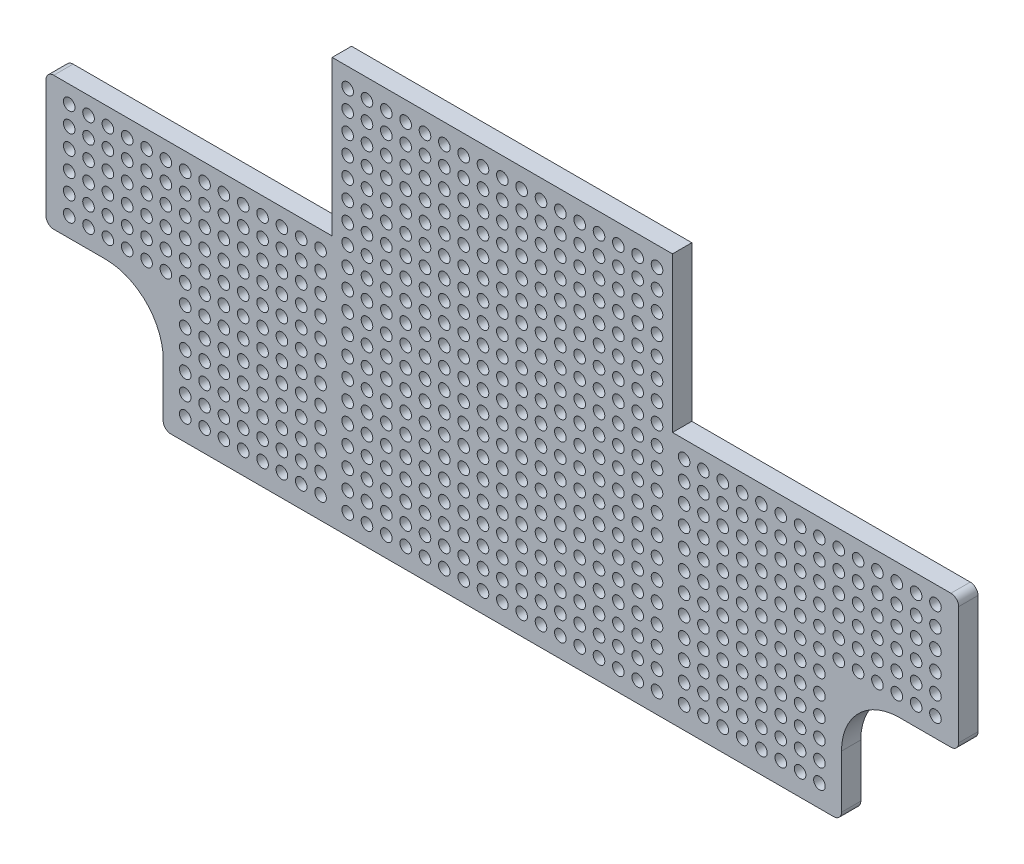
from build123d import *

# Parameters (mm, degrees)
ESQUISSE1_R        = 1.5
BOSS_EXTRU_1_DEPTH = 5
CONG_1_R           = 2


with BuildPart() as part:
    # Esquisse1 → Boss.-Extru.1 (new body)
    with BuildSketch(Plane.XY):
        with BuildLine():
            Line((30.3, 15.7), (30.3, 0))
            Line((30.3, 0), (205.7, 0))
            Line((205.7, 0), (205.7, 15.7))
            ThreePointArc((205.7, 15.7), (210.093398282, 26.306601718), (220.7, 30.7))
            Line((220.7, 30.7), (236, 30.7))
            Line((236, 30.7), (236, 65.2))
            Line((236, 65.2), (162, 65.2))
            Line((162, 65.2), (162, 105.2))
            Line((162, 105.2), (74, 105.2))
            Line((74, 105.2), (74, 65.2))
            Line((74, 65.2), (0, 65.2))
            Line((0, 65.2), (0, 30.7))
            Line((0, 30.7), (15.3, 30.7))
            ThreePointArc((15.3, 30.7), (25.906601718, 26.306601718), (30.3, 15.7))
        make_face()
        with Locations((36, 5.7)):
            Circle(ESQUISSE1_R, mode=Mode.SUBTRACT)
        with Locations((41, 5.7)):
            Circle(ESQUISSE1_R, mode=Mode.SUBTRACT)
        with Locations((46, 5.7)):
            Circle(ESQUISSE1_R, mode=Mode.SUBTRACT)
        with Locations((51, 5.7)):
            Circle(ESQUISSE1_R, mode=Mode.SUBTRACT)
        with Locations((56, 5.7)):
            Circle(ESQUISSE1_R, mode=Mode.SUBTRACT)
        with Locations((36, 10.7)):
            Circle(ESQUISSE1_R, mode=Mode.SUBTRACT)
        with Locations((41, 10.7)):
            Circle(ESQUISSE1_R, mode=Mode.SUBTRACT)
        with Locations((46, 10.7)):
            Circle(ESQUISSE1_R, mode=Mode.SUBTRACT)
        with Locations((51, 10.7)):
            Circle(ESQUISSE1_R, mode=Mode.SUBTRACT)
        with Locations((56, 10.7)):
            Circle(ESQUISSE1_R, mode=Mode.SUBTRACT)
        with Locations((36, 15.7)):
            Circle(ESQUISSE1_R, mode=Mode.SUBTRACT)
        with Locations((41, 15.7)):
            Circle(ESQUISSE1_R, mode=Mode.SUBTRACT)
        with Locations((46, 15.7)):
            Circle(ESQUISSE1_R, mode=Mode.SUBTRACT)
        with Locations((51, 15.7)):
            Circle(ESQUISSE1_R, mode=Mode.SUBTRACT)
        with Locations((56, 15.7)):
            Circle(ESQUISSE1_R, mode=Mode.SUBTRACT)
        with Locations((36, 20.7)):
            Circle(ESQUISSE1_R, mode=Mode.SUBTRACT)
        with Locations((41, 20.7)):
            Circle(ESQUISSE1_R, mode=Mode.SUBTRACT)
        with Locations((36, 25.7)):
            Circle(ESQUISSE1_R, mode=Mode.SUBTRACT)
        with Locations((41, 25.7)):
            Circle(ESQUISSE1_R, mode=Mode.SUBTRACT)
        with Locations((46, 20.7)):
            Circle(ESQUISSE1_R, mode=Mode.SUBTRACT)
        with Locations((51, 20.7)):
            Circle(ESQUISSE1_R, mode=Mode.SUBTRACT)
        with Locations((56, 20.7)):
            Circle(ESQUISSE1_R, mode=Mode.SUBTRACT)
        with Locations((46, 25.7)):
            Circle(ESQUISSE1_R, mode=Mode.SUBTRACT)
        with Locations((51, 25.7)):
            Circle(ESQUISSE1_R, mode=Mode.SUBTRACT)
        with Locations((56, 25.7)):
            Circle(ESQUISSE1_R, mode=Mode.SUBTRACT)
        with Locations((61, 5.7)):
            Circle(ESQUISSE1_R, mode=Mode.SUBTRACT)
        with Locations((66, 5.7)):
            Circle(ESQUISSE1_R, mode=Mode.SUBTRACT)
        with Locations((71, 5.7)):
            Circle(ESQUISSE1_R, mode=Mode.SUBTRACT)
        with Locations((78, 5.2)):
            Circle(ESQUISSE1_R, mode=Mode.SUBTRACT)
        with Locations((83, 5.2)):
            Circle(ESQUISSE1_R, mode=Mode.SUBTRACT)
        with Locations((88, 5.2)):
            Circle(ESQUISSE1_R, mode=Mode.SUBTRACT)
        with Locations((61, 10.7)):
            Circle(ESQUISSE1_R, mode=Mode.SUBTRACT)
        with Locations((66, 10.7)):
            Circle(ESQUISSE1_R, mode=Mode.SUBTRACT)
        with Locations((71, 10.7)):
            Circle(ESQUISSE1_R, mode=Mode.SUBTRACT)
        with Locations((78, 10.2)):
            Circle(ESQUISSE1_R, mode=Mode.SUBTRACT)
        with Locations((83, 10.2)):
            Circle(ESQUISSE1_R, mode=Mode.SUBTRACT)
        with Locations((88, 10.2)):
            Circle(ESQUISSE1_R, mode=Mode.SUBTRACT)
        with Locations((93, 5.2)):
            Circle(ESQUISSE1_R, mode=Mode.SUBTRACT)
        with Locations((98, 5.2)):
            Circle(ESQUISSE1_R, mode=Mode.SUBTRACT)
        with Locations((103, 5.2)):
            Circle(ESQUISSE1_R, mode=Mode.SUBTRACT)
        with Locations((108, 5.2)):
            Circle(ESQUISSE1_R, mode=Mode.SUBTRACT)
        with Locations((113, 5.2)):
            Circle(ESQUISSE1_R, mode=Mode.SUBTRACT)
        with Locations((93, 10.2)):
            Circle(ESQUISSE1_R, mode=Mode.SUBTRACT)
        with Locations((98, 10.2)):
            Circle(ESQUISSE1_R, mode=Mode.SUBTRACT)
        with Locations((103, 10.2)):
            Circle(ESQUISSE1_R, mode=Mode.SUBTRACT)
        with Locations((108, 10.2)):
            Circle(ESQUISSE1_R, mode=Mode.SUBTRACT)
        with Locations((113, 10.2)):
            Circle(ESQUISSE1_R, mode=Mode.SUBTRACT)
        with Locations((61, 15.7)):
            Circle(ESQUISSE1_R, mode=Mode.SUBTRACT)
        with Locations((66, 15.7)):
            Circle(ESQUISSE1_R, mode=Mode.SUBTRACT)
        with Locations((71, 15.7)):
            Circle(ESQUISSE1_R, mode=Mode.SUBTRACT)
        with Locations((78, 15.2)):
            Circle(ESQUISSE1_R, mode=Mode.SUBTRACT)
        with Locations((83, 15.2)):
            Circle(ESQUISSE1_R, mode=Mode.SUBTRACT)
        with Locations((88, 15.2)):
            Circle(ESQUISSE1_R, mode=Mode.SUBTRACT)
        with Locations((61, 20.7)):
            Circle(ESQUISSE1_R, mode=Mode.SUBTRACT)
        with Locations((66, 20.7)):
            Circle(ESQUISSE1_R, mode=Mode.SUBTRACT)
        with Locations((71, 20.7)):
            Circle(ESQUISSE1_R, mode=Mode.SUBTRACT)
        with Locations((61, 25.7)):
            Circle(ESQUISSE1_R, mode=Mode.SUBTRACT)
        with Locations((66, 25.7)):
            Circle(ESQUISSE1_R, mode=Mode.SUBTRACT)
        with Locations((71, 25.7)):
            Circle(ESQUISSE1_R, mode=Mode.SUBTRACT)
        with Locations((78, 20.2)):
            Circle(ESQUISSE1_R, mode=Mode.SUBTRACT)
        with Locations((83, 20.2)):
            Circle(ESQUISSE1_R, mode=Mode.SUBTRACT)
        with Locations((88, 20.2)):
            Circle(ESQUISSE1_R, mode=Mode.SUBTRACT)
        with Locations((78, 25.2)):
            Circle(ESQUISSE1_R, mode=Mode.SUBTRACT)
        with Locations((83, 25.2)):
            Circle(ESQUISSE1_R, mode=Mode.SUBTRACT)
        with Locations((88, 25.2)):
            Circle(ESQUISSE1_R, mode=Mode.SUBTRACT)
        with Locations((93, 15.2)):
            Circle(ESQUISSE1_R, mode=Mode.SUBTRACT)
        with Locations((98, 15.2)):
            Circle(ESQUISSE1_R, mode=Mode.SUBTRACT)
        with Locations((103, 15.2)):
            Circle(ESQUISSE1_R, mode=Mode.SUBTRACT)
        with Locations((108, 15.2)):
            Circle(ESQUISSE1_R, mode=Mode.SUBTRACT)
        with Locations((113, 15.2)):
            Circle(ESQUISSE1_R, mode=Mode.SUBTRACT)
        with Locations((93, 20.2)):
            Circle(ESQUISSE1_R, mode=Mode.SUBTRACT)
        with Locations((98, 20.2)):
            Circle(ESQUISSE1_R, mode=Mode.SUBTRACT)
        with Locations((103, 20.2)):
            Circle(ESQUISSE1_R, mode=Mode.SUBTRACT)
        with Locations((93, 25.2)):
            Circle(ESQUISSE1_R, mode=Mode.SUBTRACT)
        with Locations((98, 25.2)):
            Circle(ESQUISSE1_R, mode=Mode.SUBTRACT)
        with Locations((103, 25.2)):
            Circle(ESQUISSE1_R, mode=Mode.SUBTRACT)
        with Locations((108, 20.2)):
            Circle(ESQUISSE1_R, mode=Mode.SUBTRACT)
        with Locations((113, 20.2)):
            Circle(ESQUISSE1_R, mode=Mode.SUBTRACT)
        with Locations((108, 25.2)):
            Circle(ESQUISSE1_R, mode=Mode.SUBTRACT)
        with Locations((113, 25.2)):
            Circle(ESQUISSE1_R, mode=Mode.SUBTRACT)
        with Locations((6, 35.7)):
            Circle(ESQUISSE1_R, mode=Mode.SUBTRACT)
        with Locations((11, 35.7)):
            Circle(ESQUISSE1_R, mode=Mode.SUBTRACT)
        with Locations((16, 35.7)):
            Circle(ESQUISSE1_R, mode=Mode.SUBTRACT)
        with Locations((21, 35.7)):
            Circle(ESQUISSE1_R, mode=Mode.SUBTRACT)
        with Locations((26, 35.7)):
            Circle(ESQUISSE1_R, mode=Mode.SUBTRACT)
        with Locations((36, 30.7)):
            Circle(ESQUISSE1_R, mode=Mode.SUBTRACT)
        with Locations((41, 30.7)):
            Circle(ESQUISSE1_R, mode=Mode.SUBTRACT)
        with Locations((46, 30.7)):
            Circle(ESQUISSE1_R, mode=Mode.SUBTRACT)
        with Locations((51, 30.7)):
            Circle(ESQUISSE1_R, mode=Mode.SUBTRACT)
        with Locations((56, 30.7)):
            Circle(ESQUISSE1_R, mode=Mode.SUBTRACT)
        with Locations((31, 35.7)):
            Circle(ESQUISSE1_R, mode=Mode.SUBTRACT)
        with Locations((36, 35.7)):
            Circle(ESQUISSE1_R, mode=Mode.SUBTRACT)
        with Locations((41, 35.7)):
            Circle(ESQUISSE1_R, mode=Mode.SUBTRACT)
        with Locations((46, 35.7)):
            Circle(ESQUISSE1_R, mode=Mode.SUBTRACT)
        with Locations((51, 35.7)):
            Circle(ESQUISSE1_R, mode=Mode.SUBTRACT)
        with Locations((56, 35.7)):
            Circle(ESQUISSE1_R, mode=Mode.SUBTRACT)
        with Locations((6, 40.7)):
            Circle(ESQUISSE1_R, mode=Mode.SUBTRACT)
        with Locations((11, 40.7)):
            Circle(ESQUISSE1_R, mode=Mode.SUBTRACT)
        with Locations((6, 45.7)):
            Circle(ESQUISSE1_R, mode=Mode.SUBTRACT)
        with Locations((11, 45.7)):
            Circle(ESQUISSE1_R, mode=Mode.SUBTRACT)
        with Locations((16, 40.7)):
            Circle(ESQUISSE1_R, mode=Mode.SUBTRACT)
        with Locations((21, 40.7)):
            Circle(ESQUISSE1_R, mode=Mode.SUBTRACT)
        with Locations((26, 40.7)):
            Circle(ESQUISSE1_R, mode=Mode.SUBTRACT)
        with Locations((16, 45.7)):
            Circle(ESQUISSE1_R, mode=Mode.SUBTRACT)
        with Locations((21, 45.7)):
            Circle(ESQUISSE1_R, mode=Mode.SUBTRACT)
        with Locations((26, 45.7)):
            Circle(ESQUISSE1_R, mode=Mode.SUBTRACT)
        with Locations((6, 50.7)):
            Circle(ESQUISSE1_R, mode=Mode.SUBTRACT)
        with Locations((11, 50.7)):
            Circle(ESQUISSE1_R, mode=Mode.SUBTRACT)
        with Locations((16, 50.7)):
            Circle(ESQUISSE1_R, mode=Mode.SUBTRACT)
        with Locations((21, 50.7)):
            Circle(ESQUISSE1_R, mode=Mode.SUBTRACT)
        with Locations((26, 50.7)):
            Circle(ESQUISSE1_R, mode=Mode.SUBTRACT)
        with Locations((31, 40.7)):
            Circle(ESQUISSE1_R, mode=Mode.SUBTRACT)
        with Locations((36, 40.7)):
            Circle(ESQUISSE1_R, mode=Mode.SUBTRACT)
        with Locations((41, 40.7)):
            Circle(ESQUISSE1_R, mode=Mode.SUBTRACT)
        with Locations((31, 45.7)):
            Circle(ESQUISSE1_R, mode=Mode.SUBTRACT)
        with Locations((36, 45.7)):
            Circle(ESQUISSE1_R, mode=Mode.SUBTRACT)
        with Locations((41, 45.7)):
            Circle(ESQUISSE1_R, mode=Mode.SUBTRACT)
        with Locations((46, 40.7)):
            Circle(ESQUISSE1_R, mode=Mode.SUBTRACT)
        with Locations((51, 40.7)):
            Circle(ESQUISSE1_R, mode=Mode.SUBTRACT)
        with Locations((56, 40.7)):
            Circle(ESQUISSE1_R, mode=Mode.SUBTRACT)
        with Locations((46, 45.7)):
            Circle(ESQUISSE1_R, mode=Mode.SUBTRACT)
        with Locations((51, 45.7)):
            Circle(ESQUISSE1_R, mode=Mode.SUBTRACT)
        with Locations((56, 45.7)):
            Circle(ESQUISSE1_R, mode=Mode.SUBTRACT)
        with Locations((31, 50.7)):
            Circle(ESQUISSE1_R, mode=Mode.SUBTRACT)
        with Locations((36, 50.7)):
            Circle(ESQUISSE1_R, mode=Mode.SUBTRACT)
        with Locations((41, 50.7)):
            Circle(ESQUISSE1_R, mode=Mode.SUBTRACT)
        with Locations((46, 50.7)):
            Circle(ESQUISSE1_R, mode=Mode.SUBTRACT)
        with Locations((51, 50.7)):
            Circle(ESQUISSE1_R, mode=Mode.SUBTRACT)
        with Locations((56, 50.7)):
            Circle(ESQUISSE1_R, mode=Mode.SUBTRACT)
        with Locations((61, 30.7)):
            Circle(ESQUISSE1_R, mode=Mode.SUBTRACT)
        with Locations((66, 30.7)):
            Circle(ESQUISSE1_R, mode=Mode.SUBTRACT)
        with Locations((71, 30.7)):
            Circle(ESQUISSE1_R, mode=Mode.SUBTRACT)
        with Locations((78, 30.2)):
            Circle(ESQUISSE1_R, mode=Mode.SUBTRACT)
        with Locations((83, 30.2)):
            Circle(ESQUISSE1_R, mode=Mode.SUBTRACT)
        with Locations((88, 30.2)):
            Circle(ESQUISSE1_R, mode=Mode.SUBTRACT)
        with Locations((61, 35.7)):
            Circle(ESQUISSE1_R, mode=Mode.SUBTRACT)
        with Locations((66, 35.7)):
            Circle(ESQUISSE1_R, mode=Mode.SUBTRACT)
        with Locations((71, 35.7)):
            Circle(ESQUISSE1_R, mode=Mode.SUBTRACT)
        with Locations((78, 35.2)):
            Circle(ESQUISSE1_R, mode=Mode.SUBTRACT)
        with Locations((83, 35.2)):
            Circle(ESQUISSE1_R, mode=Mode.SUBTRACT)
        with Locations((88, 35.2)):
            Circle(ESQUISSE1_R, mode=Mode.SUBTRACT)
        with Locations((93, 30.2)):
            Circle(ESQUISSE1_R, mode=Mode.SUBTRACT)
        with Locations((98, 30.2)):
            Circle(ESQUISSE1_R, mode=Mode.SUBTRACT)
        with Locations((103, 30.2)):
            Circle(ESQUISSE1_R, mode=Mode.SUBTRACT)
        with Locations((108, 30.2)):
            Circle(ESQUISSE1_R, mode=Mode.SUBTRACT)
        with Locations((113, 30.2)):
            Circle(ESQUISSE1_R, mode=Mode.SUBTRACT)
        with Locations((93, 35.2)):
            Circle(ESQUISSE1_R, mode=Mode.SUBTRACT)
        with Locations((98, 35.2)):
            Circle(ESQUISSE1_R, mode=Mode.SUBTRACT)
        with Locations((103, 35.2)):
            Circle(ESQUISSE1_R, mode=Mode.SUBTRACT)
        with Locations((108, 35.2)):
            Circle(ESQUISSE1_R, mode=Mode.SUBTRACT)
        with Locations((113, 35.2)):
            Circle(ESQUISSE1_R, mode=Mode.SUBTRACT)
        with Locations((61, 40.7)):
            Circle(ESQUISSE1_R, mode=Mode.SUBTRACT)
        with Locations((66, 40.7)):
            Circle(ESQUISSE1_R, mode=Mode.SUBTRACT)
        with Locations((71, 40.7)):
            Circle(ESQUISSE1_R, mode=Mode.SUBTRACT)
        with Locations((61, 45.7)):
            Circle(ESQUISSE1_R, mode=Mode.SUBTRACT)
        with Locations((66, 45.7)):
            Circle(ESQUISSE1_R, mode=Mode.SUBTRACT)
        with Locations((71, 45.7)):
            Circle(ESQUISSE1_R, mode=Mode.SUBTRACT)
        with Locations((78, 40.2)):
            Circle(ESQUISSE1_R, mode=Mode.SUBTRACT)
        with Locations((83, 40.2)):
            Circle(ESQUISSE1_R, mode=Mode.SUBTRACT)
        with Locations((88, 40.2)):
            Circle(ESQUISSE1_R, mode=Mode.SUBTRACT)
        with Locations((78, 45.2)):
            Circle(ESQUISSE1_R, mode=Mode.SUBTRACT)
        with Locations((83, 45.2)):
            Circle(ESQUISSE1_R, mode=Mode.SUBTRACT)
        with Locations((88, 45.2)):
            Circle(ESQUISSE1_R, mode=Mode.SUBTRACT)
        with Locations((61, 50.7)):
            Circle(ESQUISSE1_R, mode=Mode.SUBTRACT)
        with Locations((66, 50.7)):
            Circle(ESQUISSE1_R, mode=Mode.SUBTRACT)
        with Locations((71, 50.7)):
            Circle(ESQUISSE1_R, mode=Mode.SUBTRACT)
        with Locations((78, 50.2)):
            Circle(ESQUISSE1_R, mode=Mode.SUBTRACT)
        with Locations((83, 50.2)):
            Circle(ESQUISSE1_R, mode=Mode.SUBTRACT)
        with Locations((88, 50.2)):
            Circle(ESQUISSE1_R, mode=Mode.SUBTRACT)
        with Locations((93, 40.2)):
            Circle(ESQUISSE1_R, mode=Mode.SUBTRACT)
        with Locations((98, 40.2)):
            Circle(ESQUISSE1_R, mode=Mode.SUBTRACT)
        with Locations((103, 40.2)):
            Circle(ESQUISSE1_R, mode=Mode.SUBTRACT)
        with Locations((93, 45.2)):
            Circle(ESQUISSE1_R, mode=Mode.SUBTRACT)
        with Locations((98, 45.2)):
            Circle(ESQUISSE1_R, mode=Mode.SUBTRACT)
        with Locations((103, 45.2)):
            Circle(ESQUISSE1_R, mode=Mode.SUBTRACT)
        with Locations((108, 40.2)):
            Circle(ESQUISSE1_R, mode=Mode.SUBTRACT)
        with Locations((113, 40.2)):
            Circle(ESQUISSE1_R, mode=Mode.SUBTRACT)
        with Locations((108, 45.2)):
            Circle(ESQUISSE1_R, mode=Mode.SUBTRACT)
        with Locations((113, 45.2)):
            Circle(ESQUISSE1_R, mode=Mode.SUBTRACT)
        with Locations((93, 50.2)):
            Circle(ESQUISSE1_R, mode=Mode.SUBTRACT)
        with Locations((98, 50.2)):
            Circle(ESQUISSE1_R, mode=Mode.SUBTRACT)
        with Locations((103, 50.2)):
            Circle(ESQUISSE1_R, mode=Mode.SUBTRACT)
        with Locations((108, 50.2)):
            Circle(ESQUISSE1_R, mode=Mode.SUBTRACT)
        with Locations((113, 50.2)):
            Circle(ESQUISSE1_R, mode=Mode.SUBTRACT)
        with Locations((118, 5.2)):
            Circle(ESQUISSE1_R, mode=Mode.SUBTRACT)
        with Locations((123, 5.2)):
            Circle(ESQUISSE1_R, mode=Mode.SUBTRACT)
        with Locations((128, 5.2)):
            Circle(ESQUISSE1_R, mode=Mode.SUBTRACT)
        with Locations((133, 5.2)):
            Circle(ESQUISSE1_R, mode=Mode.SUBTRACT)
        with Locations((138, 5.2)):
            Circle(ESQUISSE1_R, mode=Mode.SUBTRACT)
        with Locations((143, 5.2)):
            Circle(ESQUISSE1_R, mode=Mode.SUBTRACT)
        with Locations((118, 10.2)):
            Circle(ESQUISSE1_R, mode=Mode.SUBTRACT)
        with Locations((123, 10.2)):
            Circle(ESQUISSE1_R, mode=Mode.SUBTRACT)
        with Locations((128, 10.2)):
            Circle(ESQUISSE1_R, mode=Mode.SUBTRACT)
        with Locations((133, 10.2)):
            Circle(ESQUISSE1_R, mode=Mode.SUBTRACT)
        with Locations((138, 10.2)):
            Circle(ESQUISSE1_R, mode=Mode.SUBTRACT)
        with Locations((143, 10.2)):
            Circle(ESQUISSE1_R, mode=Mode.SUBTRACT)
        with Locations((148, 5.2)):
            Circle(ESQUISSE1_R, mode=Mode.SUBTRACT)
        with Locations((153, 5.2)):
            Circle(ESQUISSE1_R, mode=Mode.SUBTRACT)
        with Locations((158, 5.2)):
            Circle(ESQUISSE1_R, mode=Mode.SUBTRACT)
        with Locations((165, 5.7)):
            Circle(ESQUISSE1_R, mode=Mode.SUBTRACT)
        with Locations((170, 5.7)):
            Circle(ESQUISSE1_R, mode=Mode.SUBTRACT)
        with Locations((175, 5.7)):
            Circle(ESQUISSE1_R, mode=Mode.SUBTRACT)
        with Locations((148, 10.2)):
            Circle(ESQUISSE1_R, mode=Mode.SUBTRACT)
        with Locations((153, 10.2)):
            Circle(ESQUISSE1_R, mode=Mode.SUBTRACT)
        with Locations((158, 10.2)):
            Circle(ESQUISSE1_R, mode=Mode.SUBTRACT)
        with Locations((165, 10.7)):
            Circle(ESQUISSE1_R, mode=Mode.SUBTRACT)
        with Locations((170, 10.7)):
            Circle(ESQUISSE1_R, mode=Mode.SUBTRACT)
        with Locations((175, 10.7)):
            Circle(ESQUISSE1_R, mode=Mode.SUBTRACT)
        with Locations((118, 15.2)):
            Circle(ESQUISSE1_R, mode=Mode.SUBTRACT)
        with Locations((123, 15.2)):
            Circle(ESQUISSE1_R, mode=Mode.SUBTRACT)
        with Locations((128, 15.2)):
            Circle(ESQUISSE1_R, mode=Mode.SUBTRACT)
        with Locations((133, 15.2)):
            Circle(ESQUISSE1_R, mode=Mode.SUBTRACT)
        with Locations((138, 15.2)):
            Circle(ESQUISSE1_R, mode=Mode.SUBTRACT)
        with Locations((143, 15.2)):
            Circle(ESQUISSE1_R, mode=Mode.SUBTRACT)
        with Locations((118, 20.2)):
            Circle(ESQUISSE1_R, mode=Mode.SUBTRACT)
        with Locations((123, 20.2)):
            Circle(ESQUISSE1_R, mode=Mode.SUBTRACT)
        with Locations((128, 20.2)):
            Circle(ESQUISSE1_R, mode=Mode.SUBTRACT)
        with Locations((118, 25.2)):
            Circle(ESQUISSE1_R, mode=Mode.SUBTRACT)
        with Locations((123, 25.2)):
            Circle(ESQUISSE1_R, mode=Mode.SUBTRACT)
        with Locations((128, 25.2)):
            Circle(ESQUISSE1_R, mode=Mode.SUBTRACT)
        with Locations((133, 20.2)):
            Circle(ESQUISSE1_R, mode=Mode.SUBTRACT)
        with Locations((138, 20.2)):
            Circle(ESQUISSE1_R, mode=Mode.SUBTRACT)
        with Locations((143, 20.2)):
            Circle(ESQUISSE1_R, mode=Mode.SUBTRACT)
        with Locations((133, 25.2)):
            Circle(ESQUISSE1_R, mode=Mode.SUBTRACT)
        with Locations((138, 25.2)):
            Circle(ESQUISSE1_R, mode=Mode.SUBTRACT)
        with Locations((143, 25.2)):
            Circle(ESQUISSE1_R, mode=Mode.SUBTRACT)
        with Locations((148, 15.2)):
            Circle(ESQUISSE1_R, mode=Mode.SUBTRACT)
        with Locations((153, 15.2)):
            Circle(ESQUISSE1_R, mode=Mode.SUBTRACT)
        with Locations((158, 15.2)):
            Circle(ESQUISSE1_R, mode=Mode.SUBTRACT)
        with Locations((165, 15.7)):
            Circle(ESQUISSE1_R, mode=Mode.SUBTRACT)
        with Locations((170, 15.7)):
            Circle(ESQUISSE1_R, mode=Mode.SUBTRACT)
        with Locations((175, 15.7)):
            Circle(ESQUISSE1_R, mode=Mode.SUBTRACT)
        with Locations((148, 20.2)):
            Circle(ESQUISSE1_R, mode=Mode.SUBTRACT)
        with Locations((153, 20.2)):
            Circle(ESQUISSE1_R, mode=Mode.SUBTRACT)
        with Locations((158, 20.2)):
            Circle(ESQUISSE1_R, mode=Mode.SUBTRACT)
        with Locations((148, 25.2)):
            Circle(ESQUISSE1_R, mode=Mode.SUBTRACT)
        with Locations((153, 25.2)):
            Circle(ESQUISSE1_R, mode=Mode.SUBTRACT)
        with Locations((158, 25.2)):
            Circle(ESQUISSE1_R, mode=Mode.SUBTRACT)
        with Locations((165, 20.7)):
            Circle(ESQUISSE1_R, mode=Mode.SUBTRACT)
        with Locations((170, 20.7)):
            Circle(ESQUISSE1_R, mode=Mode.SUBTRACT)
        with Locations((175, 20.7)):
            Circle(ESQUISSE1_R, mode=Mode.SUBTRACT)
        with Locations((165, 25.7)):
            Circle(ESQUISSE1_R, mode=Mode.SUBTRACT)
        with Locations((170, 25.7)):
            Circle(ESQUISSE1_R, mode=Mode.SUBTRACT)
        with Locations((175, 25.7)):
            Circle(ESQUISSE1_R, mode=Mode.SUBTRACT)
        with Locations((180, 5.7)):
            Circle(ESQUISSE1_R, mode=Mode.SUBTRACT)
        with Locations((185, 5.7)):
            Circle(ESQUISSE1_R, mode=Mode.SUBTRACT)
        with Locations((190, 5.7)):
            Circle(ESQUISSE1_R, mode=Mode.SUBTRACT)
        with Locations((195, 5.7)):
            Circle(ESQUISSE1_R, mode=Mode.SUBTRACT)
        with Locations((200, 5.7)):
            Circle(ESQUISSE1_R, mode=Mode.SUBTRACT)
        with Locations((180, 10.7)):
            Circle(ESQUISSE1_R, mode=Mode.SUBTRACT)
        with Locations((185, 10.7)):
            Circle(ESQUISSE1_R, mode=Mode.SUBTRACT)
        with Locations((190, 10.7)):
            Circle(ESQUISSE1_R, mode=Mode.SUBTRACT)
        with Locations((195, 10.7)):
            Circle(ESQUISSE1_R, mode=Mode.SUBTRACT)
        with Locations((200, 10.7)):
            Circle(ESQUISSE1_R, mode=Mode.SUBTRACT)
        with Locations((180, 15.7)):
            Circle(ESQUISSE1_R, mode=Mode.SUBTRACT)
        with Locations((185, 15.7)):
            Circle(ESQUISSE1_R, mode=Mode.SUBTRACT)
        with Locations((190, 15.7)):
            Circle(ESQUISSE1_R, mode=Mode.SUBTRACT)
        with Locations((195, 15.7)):
            Circle(ESQUISSE1_R, mode=Mode.SUBTRACT)
        with Locations((200, 15.7)):
            Circle(ESQUISSE1_R, mode=Mode.SUBTRACT)
        with Locations((180, 20.7)):
            Circle(ESQUISSE1_R, mode=Mode.SUBTRACT)
        with Locations((185, 20.7)):
            Circle(ESQUISSE1_R, mode=Mode.SUBTRACT)
        with Locations((190, 20.7)):
            Circle(ESQUISSE1_R, mode=Mode.SUBTRACT)
        with Locations((180, 25.7)):
            Circle(ESQUISSE1_R, mode=Mode.SUBTRACT)
        with Locations((185, 25.7)):
            Circle(ESQUISSE1_R, mode=Mode.SUBTRACT)
        with Locations((190, 25.7)):
            Circle(ESQUISSE1_R, mode=Mode.SUBTRACT)
        with Locations((195, 20.7)):
            Circle(ESQUISSE1_R, mode=Mode.SUBTRACT)
        with Locations((200, 20.7)):
            Circle(ESQUISSE1_R, mode=Mode.SUBTRACT)
        with Locations((195, 25.7)):
            Circle(ESQUISSE1_R, mode=Mode.SUBTRACT)
        with Locations((200, 25.7)):
            Circle(ESQUISSE1_R, mode=Mode.SUBTRACT)
        with Locations((118, 30.2)):
            Circle(ESQUISSE1_R, mode=Mode.SUBTRACT)
        with Locations((123, 30.2)):
            Circle(ESQUISSE1_R, mode=Mode.SUBTRACT)
        with Locations((128, 30.2)):
            Circle(ESQUISSE1_R, mode=Mode.SUBTRACT)
        with Locations((133, 30.2)):
            Circle(ESQUISSE1_R, mode=Mode.SUBTRACT)
        with Locations((138, 30.2)):
            Circle(ESQUISSE1_R, mode=Mode.SUBTRACT)
        with Locations((143, 30.2)):
            Circle(ESQUISSE1_R, mode=Mode.SUBTRACT)
        with Locations((118, 35.2)):
            Circle(ESQUISSE1_R, mode=Mode.SUBTRACT)
        with Locations((123, 35.2)):
            Circle(ESQUISSE1_R, mode=Mode.SUBTRACT)
        with Locations((128, 35.2)):
            Circle(ESQUISSE1_R, mode=Mode.SUBTRACT)
        with Locations((133, 35.2)):
            Circle(ESQUISSE1_R, mode=Mode.SUBTRACT)
        with Locations((138, 35.2)):
            Circle(ESQUISSE1_R, mode=Mode.SUBTRACT)
        with Locations((143, 35.2)):
            Circle(ESQUISSE1_R, mode=Mode.SUBTRACT)
        with Locations((148, 30.2)):
            Circle(ESQUISSE1_R, mode=Mode.SUBTRACT)
        with Locations((153, 30.2)):
            Circle(ESQUISSE1_R, mode=Mode.SUBTRACT)
        with Locations((158, 30.2)):
            Circle(ESQUISSE1_R, mode=Mode.SUBTRACT)
        with Locations((165, 30.7)):
            Circle(ESQUISSE1_R, mode=Mode.SUBTRACT)
        with Locations((170, 30.7)):
            Circle(ESQUISSE1_R, mode=Mode.SUBTRACT)
        with Locations((175, 30.7)):
            Circle(ESQUISSE1_R, mode=Mode.SUBTRACT)
        with Locations((148, 35.2)):
            Circle(ESQUISSE1_R, mode=Mode.SUBTRACT)
        with Locations((153, 35.2)):
            Circle(ESQUISSE1_R, mode=Mode.SUBTRACT)
        with Locations((158, 35.2)):
            Circle(ESQUISSE1_R, mode=Mode.SUBTRACT)
        with Locations((165, 35.7)):
            Circle(ESQUISSE1_R, mode=Mode.SUBTRACT)
        with Locations((170, 35.7)):
            Circle(ESQUISSE1_R, mode=Mode.SUBTRACT)
        with Locations((175, 35.7)):
            Circle(ESQUISSE1_R, mode=Mode.SUBTRACT)
        with Locations((118, 40.2)):
            Circle(ESQUISSE1_R, mode=Mode.SUBTRACT)
        with Locations((123, 40.2)):
            Circle(ESQUISSE1_R, mode=Mode.SUBTRACT)
        with Locations((128, 40.2)):
            Circle(ESQUISSE1_R, mode=Mode.SUBTRACT)
        with Locations((118, 45.2)):
            Circle(ESQUISSE1_R, mode=Mode.SUBTRACT)
        with Locations((123, 45.2)):
            Circle(ESQUISSE1_R, mode=Mode.SUBTRACT)
        with Locations((128, 45.2)):
            Circle(ESQUISSE1_R, mode=Mode.SUBTRACT)
        with Locations((133, 40.2)):
            Circle(ESQUISSE1_R, mode=Mode.SUBTRACT)
        with Locations((138, 40.2)):
            Circle(ESQUISSE1_R, mode=Mode.SUBTRACT)
        with Locations((143, 40.2)):
            Circle(ESQUISSE1_R, mode=Mode.SUBTRACT)
        with Locations((133, 45.2)):
            Circle(ESQUISSE1_R, mode=Mode.SUBTRACT)
        with Locations((138, 45.2)):
            Circle(ESQUISSE1_R, mode=Mode.SUBTRACT)
        with Locations((143, 45.2)):
            Circle(ESQUISSE1_R, mode=Mode.SUBTRACT)
        with Locations((118, 50.2)):
            Circle(ESQUISSE1_R, mode=Mode.SUBTRACT)
        with Locations((123, 50.2)):
            Circle(ESQUISSE1_R, mode=Mode.SUBTRACT)
        with Locations((128, 50.2)):
            Circle(ESQUISSE1_R, mode=Mode.SUBTRACT)
        with Locations((133, 50.2)):
            Circle(ESQUISSE1_R, mode=Mode.SUBTRACT)
        with Locations((138, 50.2)):
            Circle(ESQUISSE1_R, mode=Mode.SUBTRACT)
        with Locations((143, 50.2)):
            Circle(ESQUISSE1_R, mode=Mode.SUBTRACT)
        with Locations((148, 40.2)):
            Circle(ESQUISSE1_R, mode=Mode.SUBTRACT)
        with Locations((153, 40.2)):
            Circle(ESQUISSE1_R, mode=Mode.SUBTRACT)
        with Locations((158, 40.2)):
            Circle(ESQUISSE1_R, mode=Mode.SUBTRACT)
        with Locations((148, 45.2)):
            Circle(ESQUISSE1_R, mode=Mode.SUBTRACT)
        with Locations((153, 45.2)):
            Circle(ESQUISSE1_R, mode=Mode.SUBTRACT)
        with Locations((158, 45.2)):
            Circle(ESQUISSE1_R, mode=Mode.SUBTRACT)
        with Locations((165, 40.7)):
            Circle(ESQUISSE1_R, mode=Mode.SUBTRACT)
        with Locations((170, 40.7)):
            Circle(ESQUISSE1_R, mode=Mode.SUBTRACT)
        with Locations((175, 40.7)):
            Circle(ESQUISSE1_R, mode=Mode.SUBTRACT)
        with Locations((165, 45.7)):
            Circle(ESQUISSE1_R, mode=Mode.SUBTRACT)
        with Locations((170, 45.7)):
            Circle(ESQUISSE1_R, mode=Mode.SUBTRACT)
        with Locations((175, 45.7)):
            Circle(ESQUISSE1_R, mode=Mode.SUBTRACT)
        with Locations((148, 50.2)):
            Circle(ESQUISSE1_R, mode=Mode.SUBTRACT)
        with Locations((153, 50.2)):
            Circle(ESQUISSE1_R, mode=Mode.SUBTRACT)
        with Locations((158, 50.2)):
            Circle(ESQUISSE1_R, mode=Mode.SUBTRACT)
        with Locations((165, 50.7)):
            Circle(ESQUISSE1_R, mode=Mode.SUBTRACT)
        with Locations((170, 50.7)):
            Circle(ESQUISSE1_R, mode=Mode.SUBTRACT)
        with Locations((175, 50.7)):
            Circle(ESQUISSE1_R, mode=Mode.SUBTRACT)
        with Locations((180, 30.7)):
            Circle(ESQUISSE1_R, mode=Mode.SUBTRACT)
        with Locations((185, 30.7)):
            Circle(ESQUISSE1_R, mode=Mode.SUBTRACT)
        with Locations((190, 30.7)):
            Circle(ESQUISSE1_R, mode=Mode.SUBTRACT)
        with Locations((195, 30.7)):
            Circle(ESQUISSE1_R, mode=Mode.SUBTRACT)
        with Locations((200, 30.7)):
            Circle(ESQUISSE1_R, mode=Mode.SUBTRACT)
        with Locations((180, 35.7)):
            Circle(ESQUISSE1_R, mode=Mode.SUBTRACT)
        with Locations((185, 35.7)):
            Circle(ESQUISSE1_R, mode=Mode.SUBTRACT)
        with Locations((190, 35.7)):
            Circle(ESQUISSE1_R, mode=Mode.SUBTRACT)
        with Locations((195, 35.7)):
            Circle(ESQUISSE1_R, mode=Mode.SUBTRACT)
        with Locations((200, 35.7)):
            Circle(ESQUISSE1_R, mode=Mode.SUBTRACT)
        with Locations((205, 35.7)):
            Circle(ESQUISSE1_R, mode=Mode.SUBTRACT)
        with Locations((210, 35.7)):
            Circle(ESQUISSE1_R, mode=Mode.SUBTRACT)
        with Locations((215, 35.7)):
            Circle(ESQUISSE1_R, mode=Mode.SUBTRACT)
        with Locations((220, 35.7)):
            Circle(ESQUISSE1_R, mode=Mode.SUBTRACT)
        with Locations((225, 35.7)):
            Circle(ESQUISSE1_R, mode=Mode.SUBTRACT)
        with Locations((230, 35.7)):
            Circle(ESQUISSE1_R, mode=Mode.SUBTRACT)
        with Locations((180, 40.7)):
            Circle(ESQUISSE1_R, mode=Mode.SUBTRACT)
        with Locations((185, 40.7)):
            Circle(ESQUISSE1_R, mode=Mode.SUBTRACT)
        with Locations((190, 40.7)):
            Circle(ESQUISSE1_R, mode=Mode.SUBTRACT)
        with Locations((180, 45.7)):
            Circle(ESQUISSE1_R, mode=Mode.SUBTRACT)
        with Locations((185, 45.7)):
            Circle(ESQUISSE1_R, mode=Mode.SUBTRACT)
        with Locations((190, 45.7)):
            Circle(ESQUISSE1_R, mode=Mode.SUBTRACT)
        with Locations((195, 40.7)):
            Circle(ESQUISSE1_R, mode=Mode.SUBTRACT)
        with Locations((200, 40.7)):
            Circle(ESQUISSE1_R, mode=Mode.SUBTRACT)
        with Locations((205, 40.7)):
            Circle(ESQUISSE1_R, mode=Mode.SUBTRACT)
        with Locations((195, 45.7)):
            Circle(ESQUISSE1_R, mode=Mode.SUBTRACT)
        with Locations((200, 45.7)):
            Circle(ESQUISSE1_R, mode=Mode.SUBTRACT)
        with Locations((205, 45.7)):
            Circle(ESQUISSE1_R, mode=Mode.SUBTRACT)
        with Locations((180, 50.7)):
            Circle(ESQUISSE1_R, mode=Mode.SUBTRACT)
        with Locations((185, 50.7)):
            Circle(ESQUISSE1_R, mode=Mode.SUBTRACT)
        with Locations((190, 50.7)):
            Circle(ESQUISSE1_R, mode=Mode.SUBTRACT)
        with Locations((195, 50.7)):
            Circle(ESQUISSE1_R, mode=Mode.SUBTRACT)
        with Locations((200, 50.7)):
            Circle(ESQUISSE1_R, mode=Mode.SUBTRACT)
        with Locations((205, 50.7)):
            Circle(ESQUISSE1_R, mode=Mode.SUBTRACT)
        with Locations((210, 40.7)):
            Circle(ESQUISSE1_R, mode=Mode.SUBTRACT)
        with Locations((215, 40.7)):
            Circle(ESQUISSE1_R, mode=Mode.SUBTRACT)
        with Locations((220, 40.7)):
            Circle(ESQUISSE1_R, mode=Mode.SUBTRACT)
        with Locations((210, 45.7)):
            Circle(ESQUISSE1_R, mode=Mode.SUBTRACT)
        with Locations((215, 45.7)):
            Circle(ESQUISSE1_R, mode=Mode.SUBTRACT)
        with Locations((220, 45.7)):
            Circle(ESQUISSE1_R, mode=Mode.SUBTRACT)
        with Locations((225, 40.7)):
            Circle(ESQUISSE1_R, mode=Mode.SUBTRACT)
        with Locations((230, 40.7)):
            Circle(ESQUISSE1_R, mode=Mode.SUBTRACT)
        with Locations((225, 45.7)):
            Circle(ESQUISSE1_R, mode=Mode.SUBTRACT)
        with Locations((230, 45.7)):
            Circle(ESQUISSE1_R, mode=Mode.SUBTRACT)
        with Locations((210, 50.7)):
            Circle(ESQUISSE1_R, mode=Mode.SUBTRACT)
        with Locations((215, 50.7)):
            Circle(ESQUISSE1_R, mode=Mode.SUBTRACT)
        with Locations((220, 50.7)):
            Circle(ESQUISSE1_R, mode=Mode.SUBTRACT)
        with Locations((225, 50.7)):
            Circle(ESQUISSE1_R, mode=Mode.SUBTRACT)
        with Locations((230, 50.7)):
            Circle(ESQUISSE1_R, mode=Mode.SUBTRACT)
        with Locations((6, 55.7)):
            Circle(ESQUISSE1_R, mode=Mode.SUBTRACT)
        with Locations((11, 55.7)):
            Circle(ESQUISSE1_R, mode=Mode.SUBTRACT)
        with Locations((16, 55.7)):
            Circle(ESQUISSE1_R, mode=Mode.SUBTRACT)
        with Locations((21, 55.7)):
            Circle(ESQUISSE1_R, mode=Mode.SUBTRACT)
        with Locations((26, 55.7)):
            Circle(ESQUISSE1_R, mode=Mode.SUBTRACT)
        with Locations((6, 60.7)):
            Circle(ESQUISSE1_R, mode=Mode.SUBTRACT)
        with Locations((11, 60.7)):
            Circle(ESQUISSE1_R, mode=Mode.SUBTRACT)
        with Locations((16, 60.7)):
            Circle(ESQUISSE1_R, mode=Mode.SUBTRACT)
        with Locations((21, 60.7)):
            Circle(ESQUISSE1_R, mode=Mode.SUBTRACT)
        with Locations((26, 60.7)):
            Circle(ESQUISSE1_R, mode=Mode.SUBTRACT)
        with Locations((31, 55.7)):
            Circle(ESQUISSE1_R, mode=Mode.SUBTRACT)
        with Locations((36, 55.7)):
            Circle(ESQUISSE1_R, mode=Mode.SUBTRACT)
        with Locations((41, 55.7)):
            Circle(ESQUISSE1_R, mode=Mode.SUBTRACT)
        with Locations((46, 55.7)):
            Circle(ESQUISSE1_R, mode=Mode.SUBTRACT)
        with Locations((51, 55.7)):
            Circle(ESQUISSE1_R, mode=Mode.SUBTRACT)
        with Locations((56, 55.7)):
            Circle(ESQUISSE1_R, mode=Mode.SUBTRACT)
        with Locations((31, 60.7)):
            Circle(ESQUISSE1_R, mode=Mode.SUBTRACT)
        with Locations((36, 60.7)):
            Circle(ESQUISSE1_R, mode=Mode.SUBTRACT)
        with Locations((41, 60.7)):
            Circle(ESQUISSE1_R, mode=Mode.SUBTRACT)
        with Locations((46, 60.7)):
            Circle(ESQUISSE1_R, mode=Mode.SUBTRACT)
        with Locations((51, 60.7)):
            Circle(ESQUISSE1_R, mode=Mode.SUBTRACT)
        with Locations((56, 60.7)):
            Circle(ESQUISSE1_R, mode=Mode.SUBTRACT)
        with Locations((61, 55.7)):
            Circle(ESQUISSE1_R, mode=Mode.SUBTRACT)
        with Locations((66, 55.7)):
            Circle(ESQUISSE1_R, mode=Mode.SUBTRACT)
        with Locations((71, 55.7)):
            Circle(ESQUISSE1_R, mode=Mode.SUBTRACT)
        with Locations((78, 55.2)):
            Circle(ESQUISSE1_R, mode=Mode.SUBTRACT)
        with Locations((83, 55.2)):
            Circle(ESQUISSE1_R, mode=Mode.SUBTRACT)
        with Locations((88, 55.2)):
            Circle(ESQUISSE1_R, mode=Mode.SUBTRACT)
        with Locations((61, 60.7)):
            Circle(ESQUISSE1_R, mode=Mode.SUBTRACT)
        with Locations((66, 60.7)):
            Circle(ESQUISSE1_R, mode=Mode.SUBTRACT)
        with Locations((71, 60.7)):
            Circle(ESQUISSE1_R, mode=Mode.SUBTRACT)
        with Locations((78, 60.2)):
            Circle(ESQUISSE1_R, mode=Mode.SUBTRACT)
        with Locations((83, 60.2)):
            Circle(ESQUISSE1_R, mode=Mode.SUBTRACT)
        with Locations((88, 60.2)):
            Circle(ESQUISSE1_R, mode=Mode.SUBTRACT)
        with Locations((78, 65.2)):
            Circle(ESQUISSE1_R, mode=Mode.SUBTRACT)
        with Locations((83, 65.2)):
            Circle(ESQUISSE1_R, mode=Mode.SUBTRACT)
        with Locations((88, 65.2)):
            Circle(ESQUISSE1_R, mode=Mode.SUBTRACT)
        with Locations((93, 55.2)):
            Circle(ESQUISSE1_R, mode=Mode.SUBTRACT)
        with Locations((98, 55.2)):
            Circle(ESQUISSE1_R, mode=Mode.SUBTRACT)
        with Locations((103, 55.2)):
            Circle(ESQUISSE1_R, mode=Mode.SUBTRACT)
        with Locations((108, 55.2)):
            Circle(ESQUISSE1_R, mode=Mode.SUBTRACT)
        with Locations((113, 55.2)):
            Circle(ESQUISSE1_R, mode=Mode.SUBTRACT)
        with Locations((93, 60.2)):
            Circle(ESQUISSE1_R, mode=Mode.SUBTRACT)
        with Locations((98, 60.2)):
            Circle(ESQUISSE1_R, mode=Mode.SUBTRACT)
        with Locations((103, 60.2)):
            Circle(ESQUISSE1_R, mode=Mode.SUBTRACT)
        with Locations((93, 65.2)):
            Circle(ESQUISSE1_R, mode=Mode.SUBTRACT)
        with Locations((98, 65.2)):
            Circle(ESQUISSE1_R, mode=Mode.SUBTRACT)
        with Locations((103, 65.2)):
            Circle(ESQUISSE1_R, mode=Mode.SUBTRACT)
        with Locations((108, 60.2)):
            Circle(ESQUISSE1_R, mode=Mode.SUBTRACT)
        with Locations((113, 60.2)):
            Circle(ESQUISSE1_R, mode=Mode.SUBTRACT)
        with Locations((108, 65.2)):
            Circle(ESQUISSE1_R, mode=Mode.SUBTRACT)
        with Locations((113, 65.2)):
            Circle(ESQUISSE1_R, mode=Mode.SUBTRACT)
        with Locations((78, 70.2)):
            Circle(ESQUISSE1_R, mode=Mode.SUBTRACT)
        with Locations((83, 70.2)):
            Circle(ESQUISSE1_R, mode=Mode.SUBTRACT)
        with Locations((88, 70.2)):
            Circle(ESQUISSE1_R, mode=Mode.SUBTRACT)
        with Locations((78, 75.2)):
            Circle(ESQUISSE1_R, mode=Mode.SUBTRACT)
        with Locations((83, 75.2)):
            Circle(ESQUISSE1_R, mode=Mode.SUBTRACT)
        with Locations((88, 75.2)):
            Circle(ESQUISSE1_R, mode=Mode.SUBTRACT)
        with Locations((93, 70.2)):
            Circle(ESQUISSE1_R, mode=Mode.SUBTRACT)
        with Locations((98, 70.2)):
            Circle(ESQUISSE1_R, mode=Mode.SUBTRACT)
        with Locations((103, 70.2)):
            Circle(ESQUISSE1_R, mode=Mode.SUBTRACT)
        with Locations((108, 70.2)):
            Circle(ESQUISSE1_R, mode=Mode.SUBTRACT)
        with Locations((113, 70.2)):
            Circle(ESQUISSE1_R, mode=Mode.SUBTRACT)
        with Locations((93, 75.2)):
            Circle(ESQUISSE1_R, mode=Mode.SUBTRACT)
        with Locations((98, 75.2)):
            Circle(ESQUISSE1_R, mode=Mode.SUBTRACT)
        with Locations((103, 75.2)):
            Circle(ESQUISSE1_R, mode=Mode.SUBTRACT)
        with Locations((108, 75.2)):
            Circle(ESQUISSE1_R, mode=Mode.SUBTRACT)
        with Locations((113, 75.2)):
            Circle(ESQUISSE1_R, mode=Mode.SUBTRACT)
        with Locations((78, 80.2)):
            Circle(ESQUISSE1_R, mode=Mode.SUBTRACT)
        with Locations((83, 80.2)):
            Circle(ESQUISSE1_R, mode=Mode.SUBTRACT)
        with Locations((88, 80.2)):
            Circle(ESQUISSE1_R, mode=Mode.SUBTRACT)
        with Locations((78, 85.2)):
            Circle(ESQUISSE1_R, mode=Mode.SUBTRACT)
        with Locations((83, 85.2)):
            Circle(ESQUISSE1_R, mode=Mode.SUBTRACT)
        with Locations((88, 85.2)):
            Circle(ESQUISSE1_R, mode=Mode.SUBTRACT)
        with Locations((78, 90.2)):
            Circle(ESQUISSE1_R, mode=Mode.SUBTRACT)
        with Locations((83, 90.2)):
            Circle(ESQUISSE1_R, mode=Mode.SUBTRACT)
        with Locations((88, 90.2)):
            Circle(ESQUISSE1_R, mode=Mode.SUBTRACT)
        with Locations((93, 80.2)):
            Circle(ESQUISSE1_R, mode=Mode.SUBTRACT)
        with Locations((98, 80.2)):
            Circle(ESQUISSE1_R, mode=Mode.SUBTRACT)
        with Locations((103, 80.2)):
            Circle(ESQUISSE1_R, mode=Mode.SUBTRACT)
        with Locations((93, 85.2)):
            Circle(ESQUISSE1_R, mode=Mode.SUBTRACT)
        with Locations((98, 85.2)):
            Circle(ESQUISSE1_R, mode=Mode.SUBTRACT)
        with Locations((103, 85.2)):
            Circle(ESQUISSE1_R, mode=Mode.SUBTRACT)
        with Locations((108, 80.2)):
            Circle(ESQUISSE1_R, mode=Mode.SUBTRACT)
        with Locations((113, 80.2)):
            Circle(ESQUISSE1_R, mode=Mode.SUBTRACT)
        with Locations((108, 85.2)):
            Circle(ESQUISSE1_R, mode=Mode.SUBTRACT)
        with Locations((113, 85.2)):
            Circle(ESQUISSE1_R, mode=Mode.SUBTRACT)
        with Locations((93, 90.2)):
            Circle(ESQUISSE1_R, mode=Mode.SUBTRACT)
        with Locations((98, 90.2)):
            Circle(ESQUISSE1_R, mode=Mode.SUBTRACT)
        with Locations((103, 90.2)):
            Circle(ESQUISSE1_R, mode=Mode.SUBTRACT)
        with Locations((108, 90.2)):
            Circle(ESQUISSE1_R, mode=Mode.SUBTRACT)
        with Locations((113, 90.2)):
            Circle(ESQUISSE1_R, mode=Mode.SUBTRACT)
        with Locations((118, 90.2)):
            Circle(ESQUISSE1_R, mode=Mode.SUBTRACT)
        with Locations((78, 95.2)):
            Circle(ESQUISSE1_R, mode=Mode.SUBTRACT)
        with Locations((83, 95.2)):
            Circle(ESQUISSE1_R, mode=Mode.SUBTRACT)
        with Locations((88, 95.2)):
            Circle(ESQUISSE1_R, mode=Mode.SUBTRACT)
        with Locations((78, 100.2)):
            Circle(ESQUISSE1_R, mode=Mode.SUBTRACT)
        with Locations((83, 100.2)):
            Circle(ESQUISSE1_R, mode=Mode.SUBTRACT)
        with Locations((88, 100.2)):
            Circle(ESQUISSE1_R, mode=Mode.SUBTRACT)
        with Locations((93, 95.2)):
            Circle(ESQUISSE1_R, mode=Mode.SUBTRACT)
        with Locations((98, 95.2)):
            Circle(ESQUISSE1_R, mode=Mode.SUBTRACT)
        with Locations((103, 95.2)):
            Circle(ESQUISSE1_R, mode=Mode.SUBTRACT)
        with Locations((108, 95.2)):
            Circle(ESQUISSE1_R, mode=Mode.SUBTRACT)
        with Locations((113, 95.2)):
            Circle(ESQUISSE1_R, mode=Mode.SUBTRACT)
        with Locations((118, 95.2)):
            Circle(ESQUISSE1_R, mode=Mode.SUBTRACT)
        with Locations((93, 100.2)):
            Circle(ESQUISSE1_R, mode=Mode.SUBTRACT)
        with Locations((98, 100.2)):
            Circle(ESQUISSE1_R, mode=Mode.SUBTRACT)
        with Locations((103, 100.2)):
            Circle(ESQUISSE1_R, mode=Mode.SUBTRACT)
        with Locations((108, 100.2)):
            Circle(ESQUISSE1_R, mode=Mode.SUBTRACT)
        with Locations((113, 100.2)):
            Circle(ESQUISSE1_R, mode=Mode.SUBTRACT)
        with Locations((118, 100.2)):
            Circle(ESQUISSE1_R, mode=Mode.SUBTRACT)
        with Locations((118, 55.2)):
            Circle(ESQUISSE1_R, mode=Mode.SUBTRACT)
        with Locations((123, 55.2)):
            Circle(ESQUISSE1_R, mode=Mode.SUBTRACT)
        with Locations((128, 55.2)):
            Circle(ESQUISSE1_R, mode=Mode.SUBTRACT)
        with Locations((133, 55.2)):
            Circle(ESQUISSE1_R, mode=Mode.SUBTRACT)
        with Locations((138, 55.2)):
            Circle(ESQUISSE1_R, mode=Mode.SUBTRACT)
        with Locations((143, 55.2)):
            Circle(ESQUISSE1_R, mode=Mode.SUBTRACT)
        with Locations((118, 60.2)):
            Circle(ESQUISSE1_R, mode=Mode.SUBTRACT)
        with Locations((123, 60.2)):
            Circle(ESQUISSE1_R, mode=Mode.SUBTRACT)
        with Locations((128, 60.2)):
            Circle(ESQUISSE1_R, mode=Mode.SUBTRACT)
        with Locations((118, 65.2)):
            Circle(ESQUISSE1_R, mode=Mode.SUBTRACT)
        with Locations((123, 65.2)):
            Circle(ESQUISSE1_R, mode=Mode.SUBTRACT)
        with Locations((128, 65.2)):
            Circle(ESQUISSE1_R, mode=Mode.SUBTRACT)
        with Locations((133, 60.2)):
            Circle(ESQUISSE1_R, mode=Mode.SUBTRACT)
        with Locations((138, 60.2)):
            Circle(ESQUISSE1_R, mode=Mode.SUBTRACT)
        with Locations((143, 60.2)):
            Circle(ESQUISSE1_R, mode=Mode.SUBTRACT)
        with Locations((133, 65.2)):
            Circle(ESQUISSE1_R, mode=Mode.SUBTRACT)
        with Locations((138, 65.2)):
            Circle(ESQUISSE1_R, mode=Mode.SUBTRACT)
        with Locations((143, 65.2)):
            Circle(ESQUISSE1_R, mode=Mode.SUBTRACT)
        with Locations((148, 55.2)):
            Circle(ESQUISSE1_R, mode=Mode.SUBTRACT)
        with Locations((153, 55.2)):
            Circle(ESQUISSE1_R, mode=Mode.SUBTRACT)
        with Locations((158, 55.2)):
            Circle(ESQUISSE1_R, mode=Mode.SUBTRACT)
        with Locations((165, 55.7)):
            Circle(ESQUISSE1_R, mode=Mode.SUBTRACT)
        with Locations((170, 55.7)):
            Circle(ESQUISSE1_R, mode=Mode.SUBTRACT)
        with Locations((175, 55.7)):
            Circle(ESQUISSE1_R, mode=Mode.SUBTRACT)
        with Locations((148, 60.2)):
            Circle(ESQUISSE1_R, mode=Mode.SUBTRACT)
        with Locations((153, 60.2)):
            Circle(ESQUISSE1_R, mode=Mode.SUBTRACT)
        with Locations((158, 60.2)):
            Circle(ESQUISSE1_R, mode=Mode.SUBTRACT)
        with Locations((148, 65.2)):
            Circle(ESQUISSE1_R, mode=Mode.SUBTRACT)
        with Locations((153, 65.2)):
            Circle(ESQUISSE1_R, mode=Mode.SUBTRACT)
        with Locations((158, 65.2)):
            Circle(ESQUISSE1_R, mode=Mode.SUBTRACT)
        with Locations((165, 60.7)):
            Circle(ESQUISSE1_R, mode=Mode.SUBTRACT)
        with Locations((170, 60.7)):
            Circle(ESQUISSE1_R, mode=Mode.SUBTRACT)
        with Locations((175, 60.7)):
            Circle(ESQUISSE1_R, mode=Mode.SUBTRACT)
        with Locations((118, 70.2)):
            Circle(ESQUISSE1_R, mode=Mode.SUBTRACT)
        with Locations((123, 70.2)):
            Circle(ESQUISSE1_R, mode=Mode.SUBTRACT)
        with Locations((128, 70.2)):
            Circle(ESQUISSE1_R, mode=Mode.SUBTRACT)
        with Locations((133, 70.2)):
            Circle(ESQUISSE1_R, mode=Mode.SUBTRACT)
        with Locations((138, 70.2)):
            Circle(ESQUISSE1_R, mode=Mode.SUBTRACT)
        with Locations((143, 70.2)):
            Circle(ESQUISSE1_R, mode=Mode.SUBTRACT)
        with Locations((118, 75.2)):
            Circle(ESQUISSE1_R, mode=Mode.SUBTRACT)
        with Locations((123, 75.2)):
            Circle(ESQUISSE1_R, mode=Mode.SUBTRACT)
        with Locations((128, 75.2)):
            Circle(ESQUISSE1_R, mode=Mode.SUBTRACT)
        with Locations((133, 75.2)):
            Circle(ESQUISSE1_R, mode=Mode.SUBTRACT)
        with Locations((138, 75.2)):
            Circle(ESQUISSE1_R, mode=Mode.SUBTRACT)
        with Locations((143, 75.2)):
            Circle(ESQUISSE1_R, mode=Mode.SUBTRACT)
        with Locations((148, 70.2)):
            Circle(ESQUISSE1_R, mode=Mode.SUBTRACT)
        with Locations((153, 70.2)):
            Circle(ESQUISSE1_R, mode=Mode.SUBTRACT)
        with Locations((158, 70.2)):
            Circle(ESQUISSE1_R, mode=Mode.SUBTRACT)
        with Locations((148, 75.2)):
            Circle(ESQUISSE1_R, mode=Mode.SUBTRACT)
        with Locations((153, 75.2)):
            Circle(ESQUISSE1_R, mode=Mode.SUBTRACT)
        with Locations((158, 75.2)):
            Circle(ESQUISSE1_R, mode=Mode.SUBTRACT)
        with Locations((180, 55.7)):
            Circle(ESQUISSE1_R, mode=Mode.SUBTRACT)
        with Locations((185, 55.7)):
            Circle(ESQUISSE1_R, mode=Mode.SUBTRACT)
        with Locations((190, 55.7)):
            Circle(ESQUISSE1_R, mode=Mode.SUBTRACT)
        with Locations((195, 55.7)):
            Circle(ESQUISSE1_R, mode=Mode.SUBTRACT)
        with Locations((200, 55.7)):
            Circle(ESQUISSE1_R, mode=Mode.SUBTRACT)
        with Locations((205, 55.7)):
            Circle(ESQUISSE1_R, mode=Mode.SUBTRACT)
        with Locations((180, 60.7)):
            Circle(ESQUISSE1_R, mode=Mode.SUBTRACT)
        with Locations((185, 60.7)):
            Circle(ESQUISSE1_R, mode=Mode.SUBTRACT)
        with Locations((190, 60.7)):
            Circle(ESQUISSE1_R, mode=Mode.SUBTRACT)
        with Locations((195, 60.7)):
            Circle(ESQUISSE1_R, mode=Mode.SUBTRACT)
        with Locations((200, 60.7)):
            Circle(ESQUISSE1_R, mode=Mode.SUBTRACT)
        with Locations((205, 60.7)):
            Circle(ESQUISSE1_R, mode=Mode.SUBTRACT)
        with Locations((210, 55.7)):
            Circle(ESQUISSE1_R, mode=Mode.SUBTRACT)
        with Locations((215, 55.7)):
            Circle(ESQUISSE1_R, mode=Mode.SUBTRACT)
        with Locations((220, 55.7)):
            Circle(ESQUISSE1_R, mode=Mode.SUBTRACT)
        with Locations((225, 55.7)):
            Circle(ESQUISSE1_R, mode=Mode.SUBTRACT)
        with Locations((230, 55.7)):
            Circle(ESQUISSE1_R, mode=Mode.SUBTRACT)
        with Locations((210, 60.7)):
            Circle(ESQUISSE1_R, mode=Mode.SUBTRACT)
        with Locations((215, 60.7)):
            Circle(ESQUISSE1_R, mode=Mode.SUBTRACT)
        with Locations((220, 60.7)):
            Circle(ESQUISSE1_R, mode=Mode.SUBTRACT)
        with Locations((225, 60.7)):
            Circle(ESQUISSE1_R, mode=Mode.SUBTRACT)
        with Locations((230, 60.7)):
            Circle(ESQUISSE1_R, mode=Mode.SUBTRACT)
        with Locations((118, 80.2)):
            Circle(ESQUISSE1_R, mode=Mode.SUBTRACT)
        with Locations((123, 80.2)):
            Circle(ESQUISSE1_R, mode=Mode.SUBTRACT)
        with Locations((128, 80.2)):
            Circle(ESQUISSE1_R, mode=Mode.SUBTRACT)
        with Locations((118, 85.2)):
            Circle(ESQUISSE1_R, mode=Mode.SUBTRACT)
        with Locations((123, 85.2)):
            Circle(ESQUISSE1_R, mode=Mode.SUBTRACT)
        with Locations((128, 85.2)):
            Circle(ESQUISSE1_R, mode=Mode.SUBTRACT)
        with Locations((133, 80.2)):
            Circle(ESQUISSE1_R, mode=Mode.SUBTRACT)
        with Locations((138, 80.2)):
            Circle(ESQUISSE1_R, mode=Mode.SUBTRACT)
        with Locations((143, 80.2)):
            Circle(ESQUISSE1_R, mode=Mode.SUBTRACT)
        with Locations((133, 85.2)):
            Circle(ESQUISSE1_R, mode=Mode.SUBTRACT)
        with Locations((138, 85.2)):
            Circle(ESQUISSE1_R, mode=Mode.SUBTRACT)
        with Locations((143, 85.2)):
            Circle(ESQUISSE1_R, mode=Mode.SUBTRACT)
        with Locations((123, 90.2)):
            Circle(ESQUISSE1_R, mode=Mode.SUBTRACT)
        with Locations((128, 90.2)):
            Circle(ESQUISSE1_R, mode=Mode.SUBTRACT)
        with Locations((133, 90.2)):
            Circle(ESQUISSE1_R, mode=Mode.SUBTRACT)
        with Locations((138, 90.2)):
            Circle(ESQUISSE1_R, mode=Mode.SUBTRACT)
        with Locations((143, 90.2)):
            Circle(ESQUISSE1_R, mode=Mode.SUBTRACT)
        with Locations((148, 80.2)):
            Circle(ESQUISSE1_R, mode=Mode.SUBTRACT)
        with Locations((153, 80.2)):
            Circle(ESQUISSE1_R, mode=Mode.SUBTRACT)
        with Locations((158, 80.2)):
            Circle(ESQUISSE1_R, mode=Mode.SUBTRACT)
        with Locations((148, 85.2)):
            Circle(ESQUISSE1_R, mode=Mode.SUBTRACT)
        with Locations((153, 85.2)):
            Circle(ESQUISSE1_R, mode=Mode.SUBTRACT)
        with Locations((158, 85.2)):
            Circle(ESQUISSE1_R, mode=Mode.SUBTRACT)
        with Locations((148, 90.2)):
            Circle(ESQUISSE1_R, mode=Mode.SUBTRACT)
        with Locations((153, 90.2)):
            Circle(ESQUISSE1_R, mode=Mode.SUBTRACT)
        with Locations((158, 90.2)):
            Circle(ESQUISSE1_R, mode=Mode.SUBTRACT)
        with Locations((123, 95.2)):
            Circle(ESQUISSE1_R, mode=Mode.SUBTRACT)
        with Locations((128, 95.2)):
            Circle(ESQUISSE1_R, mode=Mode.SUBTRACT)
        with Locations((133, 95.2)):
            Circle(ESQUISSE1_R, mode=Mode.SUBTRACT)
        with Locations((138, 95.2)):
            Circle(ESQUISSE1_R, mode=Mode.SUBTRACT)
        with Locations((143, 95.2)):
            Circle(ESQUISSE1_R, mode=Mode.SUBTRACT)
        with Locations((123, 100.2)):
            Circle(ESQUISSE1_R, mode=Mode.SUBTRACT)
        with Locations((128, 100.2)):
            Circle(ESQUISSE1_R, mode=Mode.SUBTRACT)
        with Locations((133, 100.2)):
            Circle(ESQUISSE1_R, mode=Mode.SUBTRACT)
        with Locations((138, 100.2)):
            Circle(ESQUISSE1_R, mode=Mode.SUBTRACT)
        with Locations((143, 100.2)):
            Circle(ESQUISSE1_R, mode=Mode.SUBTRACT)
        with Locations((148, 95.2)):
            Circle(ESQUISSE1_R, mode=Mode.SUBTRACT)
        with Locations((153, 95.2)):
            Circle(ESQUISSE1_R, mode=Mode.SUBTRACT)
        with Locations((158, 95.2)):
            Circle(ESQUISSE1_R, mode=Mode.SUBTRACT)
        with Locations((148, 100.2)):
            Circle(ESQUISSE1_R, mode=Mode.SUBTRACT)
        with Locations((153, 100.2)):
            Circle(ESQUISSE1_R, mode=Mode.SUBTRACT)
        with Locations((158, 100.2)):
            Circle(ESQUISSE1_R, mode=Mode.SUBTRACT)
    extrude(amount=BOSS_EXTRU_1_DEPTH)

    # Congé1
    cong_1_edges = [part.edges().sort_by_distance(p)[0] for p in [
        (0, 65.2, 2.5),
        (0, 30.7, 2.5),
        (30.3, 0, 2.5),
        (205.7, 0, 2.5),
        (236, 30.7, 2.5),
        (236, 65.2, 2.5),
    ]]
    fillet(cong_1_edges, radius=CONG_1_R)


solid = part.part
